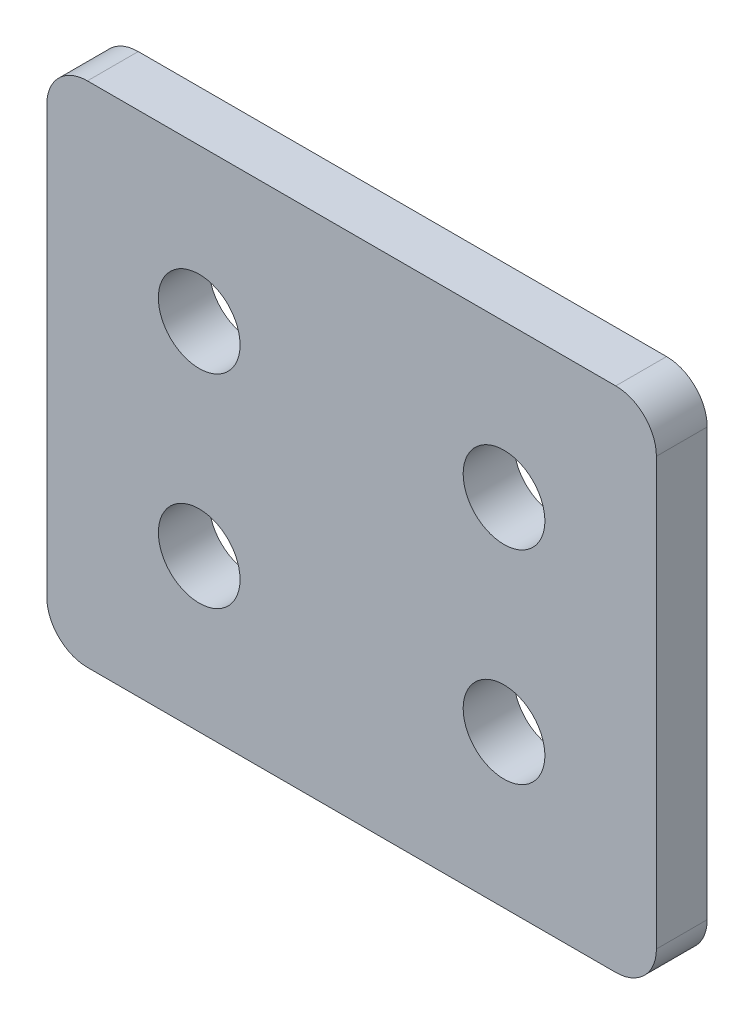
from build123d import *

# Parameters (mm, degrees)
SKETCH1_W           = 38.1
SKETCH1_H           = 31.75
SKETCH1_R           = 2.5527
BOSS_EXTRUDE1_DEPTH = 3.175
FILLET1_R           = 2.54


with BuildPart() as part:
    # Sketch1 → Boss-Extrude1 (new body)
    with BuildSketch(Plane.XY):
        Rectangle(SKETCH1_W, SKETCH1_H)
        with Locations((-9.525, -6.35)):
            Circle(SKETCH1_R, mode=Mode.SUBTRACT)
        with Locations((-9.525, 6.35)):
            Circle(SKETCH1_R, mode=Mode.SUBTRACT)
        with Locations((9.525, -6.35)):
            Circle(SKETCH1_R, mode=Mode.SUBTRACT)
        with Locations((9.525, 6.35)):
            Circle(SKETCH1_R, mode=Mode.SUBTRACT)
    extrude(amount=BOSS_EXTRUDE1_DEPTH)

    # Fillet1
    fillet1_edges = [part.edges().sort_by_distance(p)[0] for p in [
        (-19.05, 15.875, 1.5875),
        (-19.05, -15.875, 1.5875),
        (19.05, -15.875, 1.5875),
        (19.05, 15.875, 1.5875),
    ]]
    fillet(fillet1_edges, radius=FILLET1_R)


solid = part.part
